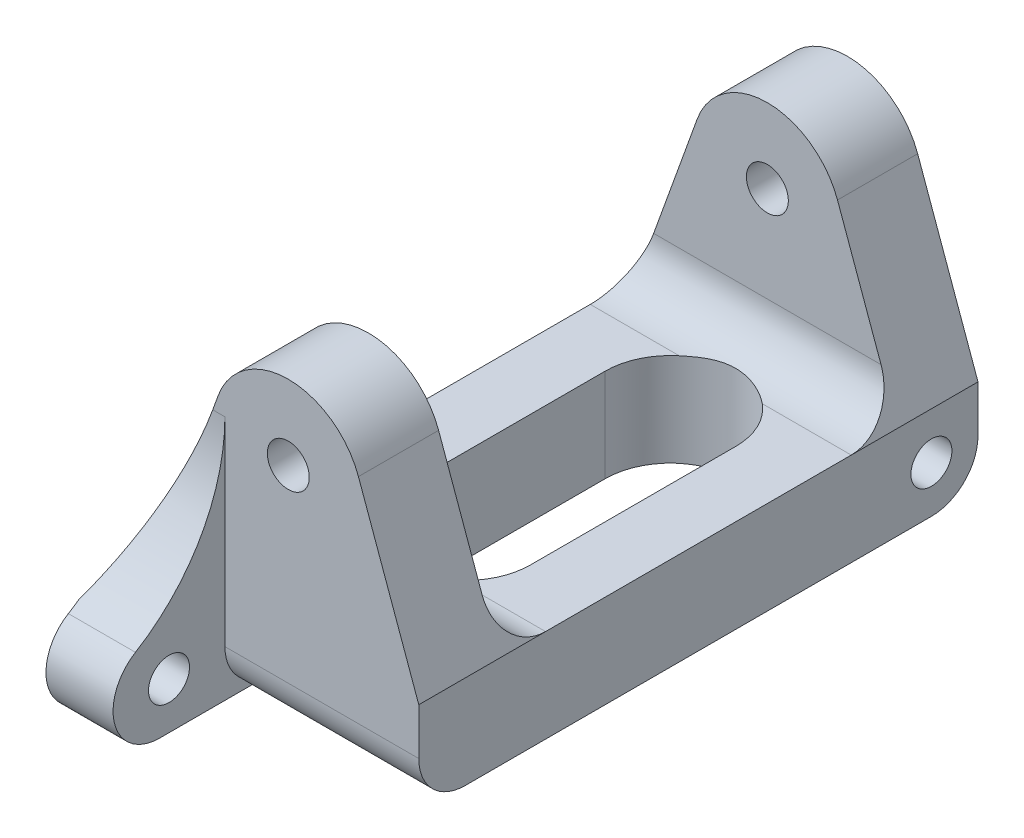
from build123d import *

# Parameters (mm, degrees)
SKETCH1_W                      = 14
SKETCH1_H                      = 15
BOSS_EXTRUDE1_DEPTH            = 5
SKETCH3_R                      = 1.1
CUT_EXTRUDE1_DEPTH             = 14
BOSS_EXTRUDE2_DEPTH            = 4.3
SKETCH5_R                      = 1.125
CUT_EXTRUDE2_DEPTH             = 4.3
FILLET1_R                      = 2.5
CUT_EXTRUDE3_REACH             = 22.227
CUT_EXTRUDE3_DIRECTION_2_REACH = 22.227
BOSS_EXTRUDE4_START            = -14
SKETCH7_R                      = 1.1
BOSS_EXTRUDE4_DEPTH            = 3.6
BOSS_EXTRUDE5_START            = -10.4
SKETCH8_R                      = 1.1
BOSS_EXTRUDE5_DEPTH            = 10.4
FILLET2_R                      = 10


with BuildPart() as part:
    # Sketch1 → Boss-Extrude1 (new body)
    with BuildSketch(Plane(origin=(0, 0, 0), x_dir=(1, 0, 0), z_dir=(0, 1, 0))):
        with Locations((0, 7.5)):
            Rectangle(SKETCH1_W, SKETCH1_H)
    extrude(amount=-BOSS_EXTRUDE1_DEPTH)

    # Sketch3 → Cut-Extrude1 (cut)
    with BuildSketch(Plane.ZY.offset(7)):
        with Locations((-12.5, -2.5)):
            Circle(SKETCH3_R)
    extrude(amount=-CUT_EXTRUDE1_DEPTH, mode=Mode.SUBTRACT)

    # Sketch4 → Boss-Extrude2 (add)
    with BuildSketch(Plane(origin=(0, 0, -15), x_dir=(-1, 0, 0), z_dir=(0, 0, -1))):
        with BuildLine():
            Line((-7, 0), (-3.763056055, 8.981248181))
            ThreePointArc((-3.763056055, 8.981248181), (0, 11.625), (3.763056055, 8.981248181))
            Line((3.763056055, 8.981248181), (7, 0))
            Line((7, 0), (-7, 0))
        make_face()
    extrude(amount=-BOSS_EXTRUDE2_DEPTH)

    # Sketch5 → Cut-Extrude2 (cut)
    with BuildSketch(Plane(origin=(0, 0, -15), x_dir=(-1, 0, 0), z_dir=(0, 0, -1))):
        with Locations((0, 7.625)):
            Circle(SKETCH5_R)
    extrude(amount=-CUT_EXTRUDE2_DEPTH, mode=Mode.SUBTRACT)

    # Fillet1
    fillet1_edges = [part.edges().sort_by_distance(p)[0] for p in [
        (0, -5, -15),
        (0, 0, -10.7),
    ]]
    fillet(fillet1_edges, radius=FILLET1_R)

    # Sketch6 → Cut-Extrude3 (cut, up to next)
    with BuildSketch(Plane(origin=(0, 0, 0), x_dir=(1, 0, 0), z_dir=(0, 1, 0)), mode=Mode.PRIVATE) as cut_extrude3_sk1:
        with BuildLine():
            Line((-3.5, -5.5), (-3.5, 5.5))
            ThreePointArc((-3.5, 5.5), (0, 9), (3.5, 5.5))
            Line((3.5, 5.5), (3.5, -5.5))
            ThreePointArc((3.5, -5.5), (0, -9), (-3.5, -5.5))
        make_face()
    cut_extrude3_tool1 = extrude(cut_extrude3_sk1.sketch, amount=-CUT_EXTRUDE3_REACH, mode=Mode.PRIVATE) & part.part
    add(cut_extrude3_tool1.solids().sort_by_distance((0, 0, 0))[0], mode=Mode.SUBTRACT)

    # Sketch6 → Cut-Extrude3 direction 2 (cut, up to next)
    with BuildSketch(Plane(origin=(0, 0, 0), x_dir=(1, 0, 0), z_dir=(0, 1, 0)), mode=Mode.PRIVATE) as cut_extrude3_direction_2_sk1:
        with BuildLine():
            Line((-3.5, -5.5), (-3.5, 5.5))
            ThreePointArc((-3.5, 5.5), (0, 9), (3.5, 5.5))
            Line((3.5, 5.5), (3.5, -5.5))
            ThreePointArc((3.5, -5.5), (0, -9), (-3.5, -5.5))
        make_face()
    cut_extrude3_direction_2_tool1 = extrude(cut_extrude3_direction_2_sk1.sketch, amount=CUT_EXTRUDE3_DIRECTION_2_REACH, mode=Mode.PRIVATE) & part.part
    add(cut_extrude3_direction_2_tool1.solids().sort_by_distance((0, 0, 0))[0], mode=Mode.SUBTRACT)

    # Mirror1: part across plane


with BuildPart() as part_1:
    add(part.part)
    add(part.part.mirror(Plane.XY))

    # Sketch7 → Boss-Extrude4 (add)
    with BuildSketch(Plane(origin=(7, 0, 0), x_dir=(0, 0, -1), z_dir=(1, 0, 0)).offset(BOSS_EXTRUDE4_START)):
        with BuildLine():
            Line((-12.5, -5), (-18.5, -5))
            ThreePointArc((-18.5, -5), (-21, -2.5), (-18.5, 0))
            Line((-18.5, 0), (-12.5, 0))
            ThreePointArc((-12.5, 0), (-10, -2.5), (-12.5, -5))
        make_face()
        with Locations((-18, -2.5)):
            Circle(SKETCH7_R, mode=Mode.SUBTRACT)
    extrude(amount=BOSS_EXTRUDE4_DEPTH)

    # Sketch8 → Boss-Extrude5 (add)
    with BuildSketch(Plane(origin=(7, 0, 0), x_dir=(0, 0, -1), z_dir=(1, 0, 0)).offset(BOSS_EXTRUDE5_START)):
        with Locations((-12.5, -2.5)):
            Circle(SKETCH8_R)
    extrude(amount=BOSS_EXTRUDE5_DEPTH)

    # Fillet2
    # the kernel refuses this fillet: 10 mm, written as the material it adds along each edge
    with BuildSketch(Plane(origin=(-7, 0, 15), x_dir=(0, 1, 0), z_dir=(1, 0, 0))) as fillet2_piece_1_section:
        with BuildLine():
            CenterArc((8.177078252, 10), FILLET2_R, 211.332251498, 58.667748502)
            Line((-0.36458435, 4.8), (-1.21875061, 4.28))
            ThreePointArc((-1.21875061, 4.28), (-1, 3.5), (-1, 0))
            Line((-1, 0), (0, -1))
            Line((0, -1), (8.177078252, -1))
            Line((8.177078252, -1), (8.177078252, 0))
        make_face()
    fillet2_piece_1 = extrude(amount=3.6, mode=Mode.PRIVATE)
    fillet2_piece_1 = split(fillet2_piece_1, bisect_by=Plane(origin=(-6.281736491, 1.992899149, 16.030712871), z_dir=(0.9407640136683284, -0.33906204533485823, 0)), keep=Keep.TOP, mode=Mode.PRIVATE)
    add(fillet2_piece_1)


solid = part_1.part
